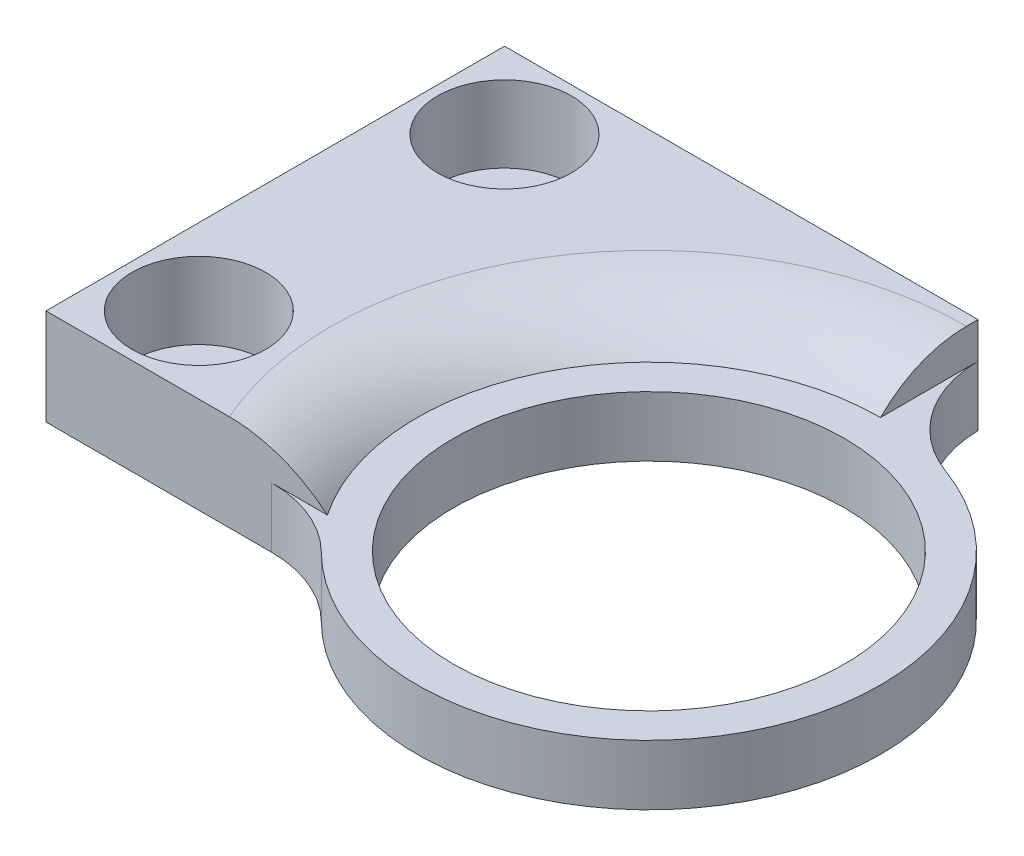
from build123d import *

# Parameters (mm, degrees)
SKETCH1_R                                        = 19.25
SKETCH1_R_2                                      = 16.25
BOSS_EXTRUDE1_DEPTH                              = 5
BOSS_EXTRUDE2_DEPTH                              = 8
CBORE_FOR_1_4_SOCKET_HEAD_CAP_SCREW1_D           = 6.7564
CBORE_FOR_1_4_SOCKET_HEAD_CAP_SCREW1_CBORE_D     = 11.1125
CBORE_FOR_1_4_SOCKET_HEAD_CAP_SCREW1_CBORE_DEPTH = 6.35
FILLET1_R                                        = 10


with BuildPart() as part:
    # Sketch1 → Boss-Extrude1 (new body)
    with BuildSketch(Plane(origin=(0, 0, 0), x_dir=(1, 0, 0), z_dir=(0, 1, 0))):
        with Locations(Location((0, 0, 0), (0, 0, 270))):
            Circle(SKETCH1_R)
        with Locations(Location((0, 0, 0), (0, 0, 270))):
            Circle(SKETCH1_R_2, mode=Mode.SUBTRACT)
    extrude(amount=BOSS_EXTRUDE1_DEPTH)

    # Sketch2 → Boss-Extrude2 (add)
    with BuildSketch(Plane(origin=(0, 0, 0), x_dir=(1, 0, 0), z_dir=(0, 1, 0))):
        with BuildLine():
            Line((0, 27.35), (-39.35, 27.35))
            Line((-39.35, 27.35), (-39.35, -10.75))
            Line((-39.35, -10.75), (-15.968719423, -10.75))
            ThreePointArc((-15.968719423, -10.75), (-16.992645468, 9.045026258), (0, 19.25))
            Line((0, 19.25), (0, 27.35))
        make_face()
    extrude(amount=BOSS_EXTRUDE2_DEPTH)

    # CBORE for 1/4 Socket Head Cap Screw1 (through all)
    with Locations(Plane(origin=(0, 8, 0), x_dir=(1, 0, 0), z_dir=(0, 1, 0))):
        with Locations((-33, 21), (-33, -4.4)):
            CounterBoreHole(CBORE_FOR_1_4_SOCKET_HEAD_CAP_SCREW1_D / 2, CBORE_FOR_1_4_SOCKET_HEAD_CAP_SCREW1_CBORE_D / 2, CBORE_FOR_1_4_SOCKET_HEAD_CAP_SCREW1_CBORE_DEPTH)

    # Fillet1
    # the kernel refuses this fillet: 10 mm, written as the material it adds along each edge
    with BuildSketch(Plane(origin=(-15.968719423, 0, 10.75), x_dir=(0.6369824352168134, 0, 0.7708783154462564), z_dir=(0, 1, 0))) as fillet1_piece_1:
        with BuildLine():
            CenterArc((4.748847629, -9.951948419), FILLET1_R, 95.619084045, 44.81374241)
            Line((-2.959935525, -3.582124067), (0, 0))
            ThreePointArc((0, 0), (1.884851894, -0.092499293), (3.769703788, 0))
        make_face()
    extrude(amount=5)
    with BuildSketch(Plane(origin=(0, 0, -19.25), x_dir=(0.984823666621771, 0, 0.1735579029075042), z_dir=(0, 1, 0))) as fillet1_piece_2:
        with BuildLine():
            CenterArc((8.417558291, 9.848236666), FILLET1_R, 190.784553847, 69.220698266)
            Line((-1.405819014, 7.9770717), (0, 0))
            ThreePointArc((0, 0), (3.340989631, 0.292144418), (6.681979262, 0))
        make_face()
    extrude(amount=5)
    # the kernel refuses this fillet: 10 mm, written as the material it takes off along each edge
    with BuildSketch(Plane(origin=(0, 8, 0), x_dir=(-0.05010434447284765, 0, 0.998743988550092), z_dir=(0.998743988550092, 0, 0.05010434447284765))) as fillet1_2_piece_1:
        with BuildLine():
            CenterArc((26.391428429, 10), FILLET1_R, 224.427004001, 45.572995999)
            Line((26.391428429, 0), (19.25, 0))
            Line((19.25, 0), (19.25, 3))
        make_face()
    revolve(axis=Axis((0, 8, 0), (0, -1, 0)), revolution_arc=230.307970534, mode=Mode.SUBTRACT)


solid = part.part
